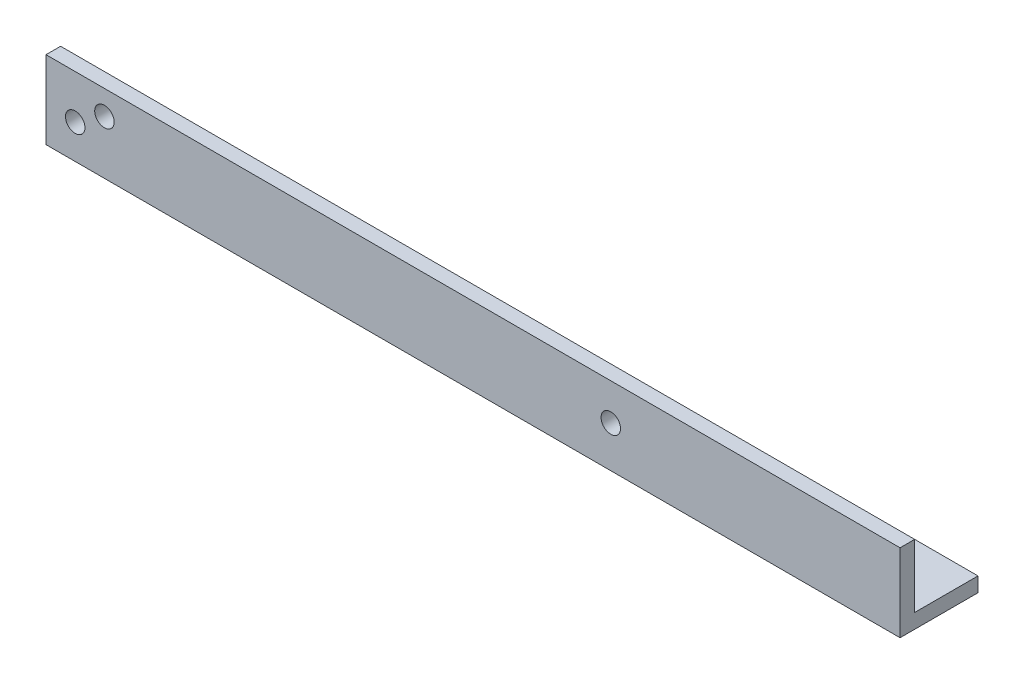
from build123d import *

# Parameters (mm, degrees)
BOSS_EXTRUDE1_DEPTH = 278.384
CUT_EXTRUDE1_REACH  = 282.301
SKETCH3_R           = 3.175
CUT_EXTRUDE2_REACH  = 282.692
SKETCH4_R           = 3.175
CUT_EXTRUDE4_REACH  = 282.692
SKETCH5_R           = 3.175


with BuildPart() as part:
    # Sketch1 → Boss-Extrude1 (new body)
    with BuildSketch(Plane(origin=(0, 0, 0), x_dir=(0, 0, -1), z_dir=(1, 0, 0))):
        Polygon((0, 0), (0, -25.4), (25.4, -25.4), (25.4, -20.6375), (4.7625, -20.6375), (4.7625, 0), align=None)
    extrude(amount=BOSS_EXTRUDE1_DEPTH)

    # Sketch3 → Cut-Extrude1 (cut, up to next)
    with BuildSketch(Plane(origin=(0, 0, -4.7625), x_dir=(-1, 0, 0), z_dir=(0, 0, -1)), mode=Mode.PRIVATE) as cut_extrude1_sk1:
        with Locations((-9.525, -14.2875)):
            Circle(SKETCH3_R)
    cut_extrude1_tool1 = extrude(cut_extrude1_sk1.sketch, amount=-CUT_EXTRUDE1_REACH, mode=Mode.PRIVATE) & part.part
    # Sketch3 → Cut-Extrude1 (cut, up to next)
    with BuildSketch(Plane(origin=(0, 0, -4.7625), x_dir=(-1, 0, 0), z_dir=(0, 0, -1)), mode=Mode.PRIVATE) as cut_extrude1_sk2:
        with Locations((-19.05, -7.9375)):
            Circle(SKETCH3_R)
    cut_extrude1_tool2 = extrude(cut_extrude1_sk2.sketch, amount=-CUT_EXTRUDE1_REACH, mode=Mode.PRIVATE) & part.part
    add(cut_extrude1_tool1.solids().sort_by_distance((9.525, -14.2875, -4.7625))[0], mode=Mode.SUBTRACT)
    add(cut_extrude1_tool2.solids().sort_by_distance((19.05, -7.9375, -4.7625))[0], mode=Mode.SUBTRACT)

    # Sketch4 → Cut-Extrude2 (cut, up to next)
    with BuildSketch(Plane.XY, mode=Mode.PRIVATE) as cut_extrude2_sk1:
        with Locations((184.095250482, -11.929615818)):
            Circle(SKETCH4_R)
    cut_extrude2_tool1 = extrude(cut_extrude2_sk1.sketch, amount=-CUT_EXTRUDE2_REACH, mode=Mode.PRIVATE) & part.part
    add(cut_extrude2_tool1.solids().sort_by_distance((184.09525, -11.929616, 0))[0], mode=Mode.SUBTRACT)

    # Sketch5 → Cut-Extrude4 (cut, up to next)
    with BuildSketch(Plane.XZ.offset(25.4), mode=Mode.PRIVATE) as cut_extrude4_sk1:
        with Locations((240.284, -12.7)):
            Circle(SKETCH5_R)
    cut_extrude4_tool1 = extrude(cut_extrude4_sk1.sketch, amount=-CUT_EXTRUDE4_REACH, mode=Mode.PRIVATE) & part.part
    # Sketch5 → Cut-Extrude4 (cut, up to next)
    with BuildSketch(Plane.XZ.offset(25.4), mode=Mode.PRIVATE) as cut_extrude4_sk2:
        with Locations((265.684, -12.7)):
            Circle(SKETCH5_R)
    cut_extrude4_tool2 = extrude(cut_extrude4_sk2.sketch, amount=-CUT_EXTRUDE4_REACH, mode=Mode.PRIVATE) & part.part
    add(cut_extrude4_tool1.solids().sort_by_distance((240.284, -25.4, -12.7))[0], mode=Mode.SUBTRACT)
    add(cut_extrude4_tool2.solids().sort_by_distance((265.684, -25.4, -12.7))[0], mode=Mode.SUBTRACT)


solid = part.part
